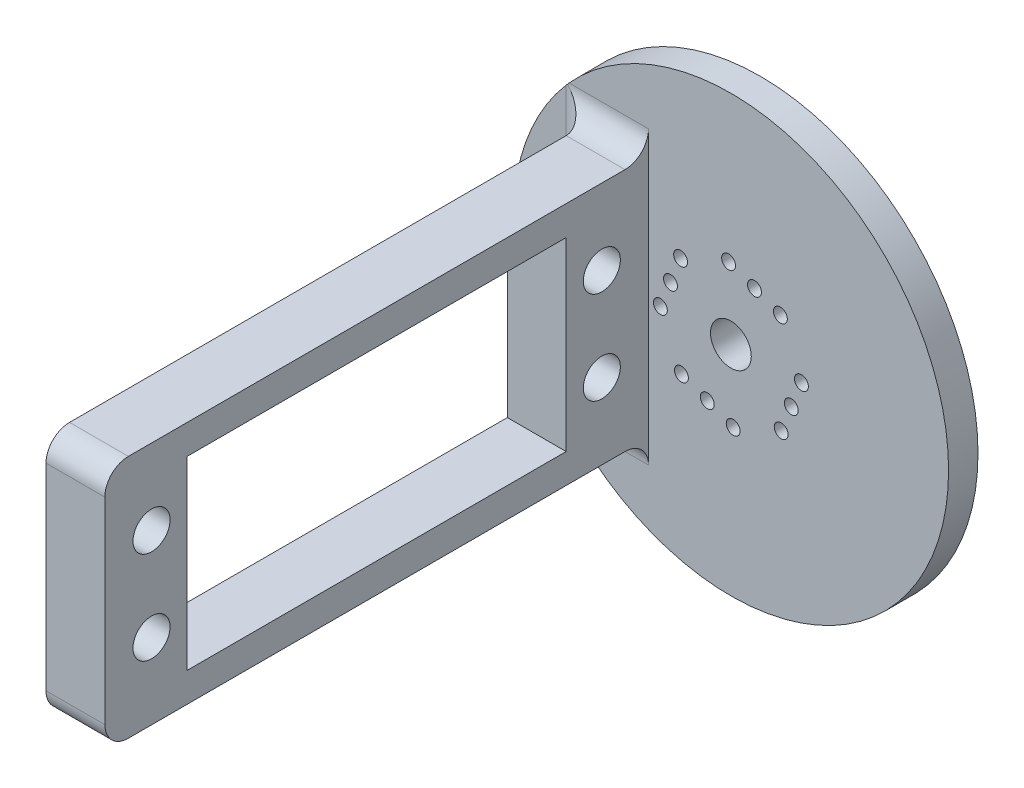
from build123d import *

# Parameters (mm, degrees)
SKETCH1_R           = 23.495
BOSS_EXTRUDE1_DEPTH = 3.175
SKETCH4_W           = 58.68
SKETCH4_H           = 26.35
SKETCH4_R           = 2
SKETCH4_W_2         = 40.9
SKETCH4_H_2         = 20
BOSS_EXTRUDE3_DEPTH = 6.35
FILLET1_R           = 2.54
CUT_EXTRUDE1_REACH  = 72.214
SKETCH5_R           = 0.75
SKETCH5_R_2         = 1.5
SKETCH6_R           = 2.2
CUT_EXTRUDE2_DEPTH  = 68.434208377
FILLET2_R           = 2.54


with BuildPart() as part:
    # Sketch1 → Boss-Extrude1 (new body)
    with BuildSketch(Plane.XY):
        Circle(SKETCH1_R)
    extrude(amount=BOSS_EXTRUDE1_DEPTH)

    # Sketch4 → Boss-Extrude3 (add)
    with BuildSketch(Plane(origin=(-8.89, 0, 0), x_dir=(0, 0, -1), z_dir=(1, 0, 0))):
        with Locations((-32.515, 0)):
            Rectangle(SKETCH4_W, SKETCH4_H)
        with Locations((-56.815, -5)):
            Circle(SKETCH4_R, mode=Mode.SUBTRACT)
        with Locations((-56.815, 5)):
            Circle(SKETCH4_R, mode=Mode.SUBTRACT)
        with Locations((-8.215, -5)):
            Circle(SKETCH4_R, mode=Mode.SUBTRACT)
        with Locations((-8.215, 5)):
            Circle(SKETCH4_R, mode=Mode.SUBTRACT)
        with Locations((-32.515, 0)):
            Rectangle(SKETCH4_W_2, SKETCH4_H_2, mode=Mode.SUBTRACT)
    extrude(amount=-BOSS_EXTRUDE3_DEPTH)

    # Fillet1
    # the kernel refuses this fillet: 2.54 mm, written as the material it adds along each edge
    with BuildSketch(Plane(origin=(-15.24, -13.175, 3.175), x_dir=(-1, 0, 0), z_dir=(0, 1, 0))) as fillet1_piece_1:
        with BuildLine():
            CenterArc((FILLET1_R, FILLET1_R), FILLET1_R, 180, 90)
            Line((0, FILLET1_R), (0, 0))
            Line((0, 0), (FILLET1_R, 0))
        make_face()
    extrude(amount=26.35)
    with BuildSketch(Plane(origin=(-8.89, 13.175, 3.175), x_dir=(0, 1, 0), z_dir=(-1, 0, 0))) as fillet1_piece_2:
        with BuildLine():
            CenterArc((FILLET1_R, -FILLET1_R), FILLET1_R, 90, 90)
            Line((0, -FILLET1_R), (0, 0))
            Line((0, 0), (FILLET1_R, 0))
        make_face()
    extrude(amount=6.35)
    with BuildSketch(Plane(origin=(-8.89, -13.175, 3.175), x_dir=(0, -1, 0), z_dir=(-1, 0, 0))) as fillet1_piece_3:
        with BuildLine():
            CenterArc((FILLET1_R, FILLET1_R), FILLET1_R, 180, 90)
            Line((0, FILLET1_R), (0, 0))
            Line((0, 0), (FILLET1_R, 0))
        make_face()
    extrude(amount=6.35)
    with BuildSketch(Plane(origin=(-15.24, -19.525, 3.175), x_dir=(-1, 0, 0), z_dir=(0, 1, 0))) as fillet1_piece_4a_section:
        with BuildLine():
            CenterArc((FILLET1_R, FILLET1_R), FILLET1_R, 180, 90)
            Line((0, FILLET1_R), (0, 0))
            Line((0, 0), (FILLET1_R, 0))
        make_face()
    fillet1_piece_4a = extrude(amount=32.7, mode=Mode.PRIVATE)
    fillet1_piece_4a = fillet1_piece_4a & Plane(origin=(0, 0, 3.789458471), x_dir=(1, 0, 0), z_dir=(0, 0, -1)) * Cylinder(23.495, 76, mode=Mode.PRIVATE)
    fillet1_piece_4a = split(fillet1_piece_4a, bisect_by=Plane(origin=(-15.747234341, -13.175, 3.789458471), z_dir=(0, -1, 0)), keep=Keep.TOP, mode=Mode.PRIVATE)
    with BuildSketch(Plane(origin=(-8.89, -13.175, 3.175), x_dir=(0, -1, 0), z_dir=(-1, 0, 0))) as fillet1_piece_4b_section:
        with BuildLine():
            CenterArc((FILLET1_R, FILLET1_R), FILLET1_R, 180, 90)
            Line((0, FILLET1_R), (0, 0))
            Line((0, 0), (FILLET1_R, 0))
        make_face()
    fillet1_piece_4b = extrude(amount=12.7, mode=Mode.PRIVATE)
    fillet1_piece_4b = fillet1_piece_4b & Plane(origin=(0, 0, 3.784403855), x_dir=(1, 0, 0), z_dir=(0, 0, -1)) * Cylinder(23.495, 36, mode=Mode.PRIVATE)
    fillet1_piece_4b = split(fillet1_piece_4b, bisect_by=Plane(origin=(-15.24, -13.690986617, 3.784403855), z_dir=(-1, 0, 0)), keep=Keep.TOP, mode=Mode.PRIVATE)
    fillet1_piece_4 = fillet1_piece_4a & fillet1_piece_4b
    add(fillet1_piece_4)
    with BuildSketch(Plane(origin=(-8.89, 13.175, 3.175), x_dir=(0, 1, 0), z_dir=(-1, 0, 0))) as fillet1_piece_5a_section:
        with BuildLine():
            CenterArc((FILLET1_R, -FILLET1_R), FILLET1_R, 90, 90)
            Line((0, -FILLET1_R), (0, 0))
            Line((0, 0), (FILLET1_R, 0))
        make_face()
    fillet1_piece_5a = extrude(amount=12.7, mode=Mode.PRIVATE)
    fillet1_piece_5a = fillet1_piece_5a & Plane(origin=(0, 0, 3.784403835), x_dir=(1, 0, 0), z_dir=(0, 0, -1)) * Cylinder(23.495, 36, mode=Mode.PRIVATE)
    fillet1_piece_5a = split(fillet1_piece_5a, bisect_by=Plane(origin=(-15.24, 13.69098675, 3.784403835), z_dir=(-1, 0, 0)), keep=Keep.TOP, mode=Mode.PRIVATE)
    with BuildSketch(Plane(origin=(-15.24, -13.175, 3.175), x_dir=(-1, 0, 0), z_dir=(0, 1, 0))) as fillet1_piece_5b_section:
        with BuildLine():
            CenterArc((FILLET1_R, FILLET1_R), FILLET1_R, 180, 90)
            Line((0, FILLET1_R), (0, 0))
            Line((0, 0), (FILLET1_R, 0))
        make_face()
    fillet1_piece_5b = extrude(amount=32.7, mode=Mode.PRIVATE)
    fillet1_piece_5b = fillet1_piece_5b & Plane(origin=(0, 0, 3.789458493), x_dir=(1, 0, 0), z_dir=(0, 0, -1)) * Cylinder(23.495, 76, mode=Mode.PRIVATE)
    fillet1_piece_5b = split(fillet1_piece_5b, bisect_by=Plane(origin=(-15.747234214, 13.175, 3.789458493), z_dir=(0, 1, 0)), keep=Keep.TOP, mode=Mode.PRIVATE)
    fillet1_piece_5 = fillet1_piece_5a & fillet1_piece_5b
    add(fillet1_piece_5)

    # Sketch5 → Cut-Extrude1 (cut, up to next)
    with BuildSketch(Plane(origin=(0, 0, 0), x_dir=(-1, 0, 0), z_dir=(0, 0, -1)), mode=Mode.PRIVATE) as cut_extrude1_sk1:
        with Locations((5.342004985, -5.427981461)):
            Circle(SKETCH5_R)
    cut_extrude1_tool1 = extrude(cut_extrude1_sk1.sketch, amount=-CUT_EXTRUDE1_REACH, mode=Mode.PRIVATE) & part.part
    # Sketch5 → Cut-Extrude1 (cut, up to next)
    with BuildSketch(Plane(origin=(0, 0, 0), x_dir=(-1, 0, 0), z_dir=(0, 0, -1)), mode=Mode.PRIVATE) as cut_extrude1_sk2:
        with Locations((2.547769545, -6.519882694)):
            Circle(SKETCH5_R)
    cut_extrude1_tool2 = extrude(cut_extrude1_sk2.sketch, amount=-CUT_EXTRUDE1_REACH, mode=Mode.PRIVATE) & part.part
    # Sketch5 → Cut-Extrude1 (cut, up to next)
    with BuildSketch(Plane(origin=(0, 0, 0), x_dir=(-1, 0, 0), z_dir=(0, 0, -1)), mode=Mode.PRIVATE) as cut_extrude1_sk3:
        with Locations((-0.246465895, -7.611783928)):
            Circle(SKETCH5_R)
    cut_extrude1_tool3 = extrude(cut_extrude1_sk3.sketch, amount=-CUT_EXTRUDE1_REACH, mode=Mode.PRIVATE) & part.part
    # Sketch5 → Cut-Extrude1 (cut, up to next)
    with BuildSketch(Plane(origin=(0, 0, 0), x_dir=(-1, 0, 0), z_dir=(0, 0, -1)), mode=Mode.PRIVATE) as cut_extrude1_sk4:
        with Locations((-5.427981461, -5.342004985)):
            Circle(SKETCH5_R)
    cut_extrude1_tool4 = extrude(cut_extrude1_sk4.sketch, amount=-CUT_EXTRUDE1_REACH, mode=Mode.PRIVATE) & part.part
    # Sketch5 → Cut-Extrude1 (cut, up to next)
    with BuildSketch(Plane(origin=(0, 0, 0), x_dir=(-1, 0, 0), z_dir=(0, 0, -1)), mode=Mode.PRIVATE) as cut_extrude1_sk5:
        with Locations((-6.519882694, -2.547769545)):
            Circle(SKETCH5_R)
    cut_extrude1_tool5 = extrude(cut_extrude1_sk5.sketch, amount=-CUT_EXTRUDE1_REACH, mode=Mode.PRIVATE) & part.part
    # Sketch5 → Cut-Extrude1 (cut, up to next)
    with BuildSketch(Plane(origin=(0, 0, 0), x_dir=(-1, 0, 0), z_dir=(0, 0, -1)), mode=Mode.PRIVATE) as cut_extrude1_sk6:
        with Locations((-7.611783928, 0.246465895)):
            Circle(SKETCH5_R)
    cut_extrude1_tool6 = extrude(cut_extrude1_sk6.sketch, amount=-CUT_EXTRUDE1_REACH, mode=Mode.PRIVATE) & part.part
    # Sketch5 → Cut-Extrude1 (cut, up to next)
    with BuildSketch(Plane(origin=(0, 0, 0), x_dir=(-1, 0, 0), z_dir=(0, 0, -1)), mode=Mode.PRIVATE) as cut_extrude1_sk7:
        with Locations((-5.342004985, 5.427981461)):
            Circle(SKETCH5_R)
    cut_extrude1_tool7 = extrude(cut_extrude1_sk7.sketch, amount=-CUT_EXTRUDE1_REACH, mode=Mode.PRIVATE) & part.part
    # Sketch5 → Cut-Extrude1 (cut, up to next)
    with BuildSketch(Plane(origin=(0, 0, 0), x_dir=(-1, 0, 0), z_dir=(0, 0, -1)), mode=Mode.PRIVATE) as cut_extrude1_sk8:
        with Locations((-2.547769545, 6.519882694)):
            Circle(SKETCH5_R)
    cut_extrude1_tool8 = extrude(cut_extrude1_sk8.sketch, amount=-CUT_EXTRUDE1_REACH, mode=Mode.PRIVATE) & part.part
    # Sketch5 → Cut-Extrude1 (cut, up to next)
    with BuildSketch(Plane(origin=(0, 0, 0), x_dir=(-1, 0, 0), z_dir=(0, 0, -1)), mode=Mode.PRIVATE) as cut_extrude1_sk9:
        with Locations((0.246465895, 7.611783928)):
            Circle(SKETCH5_R)
    cut_extrude1_tool9 = extrude(cut_extrude1_sk9.sketch, amount=-CUT_EXTRUDE1_REACH, mode=Mode.PRIVATE) & part.part
    # Sketch5 → Cut-Extrude1 (cut, up to next)
    with BuildSketch(Plane(origin=(0, 0, 0), x_dir=(-1, 0, 0), z_dir=(0, 0, -1)), mode=Mode.PRIVATE) as cut_extrude1_sk10:
        with Locations((5.427981461, 5.342004985)):
            Circle(SKETCH5_R)
    cut_extrude1_tool10 = extrude(cut_extrude1_sk10.sketch, amount=-CUT_EXTRUDE1_REACH, mode=Mode.PRIVATE) & part.part
    # Sketch5 → Cut-Extrude1 (cut, up to next)
    with BuildSketch(Plane(origin=(0, 0, 0), x_dir=(-1, 0, 0), z_dir=(0, 0, -1)), mode=Mode.PRIVATE) as cut_extrude1_sk11:
        with Locations((6.519882694, 2.547769545)):
            Circle(SKETCH5_R)
    cut_extrude1_tool11 = extrude(cut_extrude1_sk11.sketch, amount=-CUT_EXTRUDE1_REACH, mode=Mode.PRIVATE) & part.part
    # Sketch5 → Cut-Extrude1 (cut, up to next)
    with BuildSketch(Plane(origin=(0, 0, 0), x_dir=(-1, 0, 0), z_dir=(0, 0, -1)), mode=Mode.PRIVATE) as cut_extrude1_sk12:
        with Locations((7.611783928, -0.246465895)):
            Circle(SKETCH5_R)
    cut_extrude1_tool12 = extrude(cut_extrude1_sk12.sketch, amount=-CUT_EXTRUDE1_REACH, mode=Mode.PRIVATE) & part.part
    # Sketch5 → Cut-Extrude1 (cut, up to next)
    with BuildSketch(Plane(origin=(0, 0, 0), x_dir=(-1, 0, 0), z_dir=(0, 0, -1)), mode=Mode.PRIVATE) as cut_extrude1_sk13:
        Circle(SKETCH5_R_2)
    cut_extrude1_tool13 = extrude(cut_extrude1_sk13.sketch, amount=-CUT_EXTRUDE1_REACH, mode=Mode.PRIVATE) & part.part
    add(cut_extrude1_tool1.solids().sort_by_distance((-5.342005, -5.427981, 0))[0], mode=Mode.SUBTRACT)
    add(cut_extrude1_tool2.solids().sort_by_distance((-2.54777, -6.519883, 0))[0], mode=Mode.SUBTRACT)
    add(cut_extrude1_tool3.solids().sort_by_distance((0.246466, -7.611784, 0))[0], mode=Mode.SUBTRACT)
    add(cut_extrude1_tool4.solids().sort_by_distance((5.427981, -5.342005, 0))[0], mode=Mode.SUBTRACT)
    add(cut_extrude1_tool5.solids().sort_by_distance((6.519883, -2.54777, 0))[0], mode=Mode.SUBTRACT)
    add(cut_extrude1_tool6.solids().sort_by_distance((7.611784, 0.246466, 0))[0], mode=Mode.SUBTRACT)
    add(cut_extrude1_tool7.solids().sort_by_distance((5.342005, 5.427981, 0))[0], mode=Mode.SUBTRACT)
    add(cut_extrude1_tool8.solids().sort_by_distance((2.54777, 6.519883, 0))[0], mode=Mode.SUBTRACT)
    add(cut_extrude1_tool9.solids().sort_by_distance((-0.246466, 7.611784, 0))[0], mode=Mode.SUBTRACT)
    add(cut_extrude1_tool10.solids().sort_by_distance((-5.427981, 5.342005, 0))[0], mode=Mode.SUBTRACT)
    add(cut_extrude1_tool11.solids().sort_by_distance((-6.519883, 2.54777, 0))[0], mode=Mode.SUBTRACT)
    add(cut_extrude1_tool12.solids().sort_by_distance((-7.611784, -0.246466, 0))[0], mode=Mode.SUBTRACT)
    add(cut_extrude1_tool13.solids().sort_by_distance((0, 0, 0))[0], mode=Mode.SUBTRACT)

    # Sketch6 → Cut-Extrude2 (cut, through all)
    with BuildSketch(Plane.XY.offset(3.175)):
        Circle(SKETCH6_R)
    extrude(amount=-CUT_EXTRUDE2_DEPTH, mode=Mode.SUBTRACT)

    # Fillet2
    fillet2_edges = [part.edges().sort_by_distance(p)[0] for p in [
        (-12.065, -13.175, 61.855),
        (-12.065, 13.175, 61.855),
    ]]
    fillet(fillet2_edges, radius=FILLET2_R)


solid = part.part
